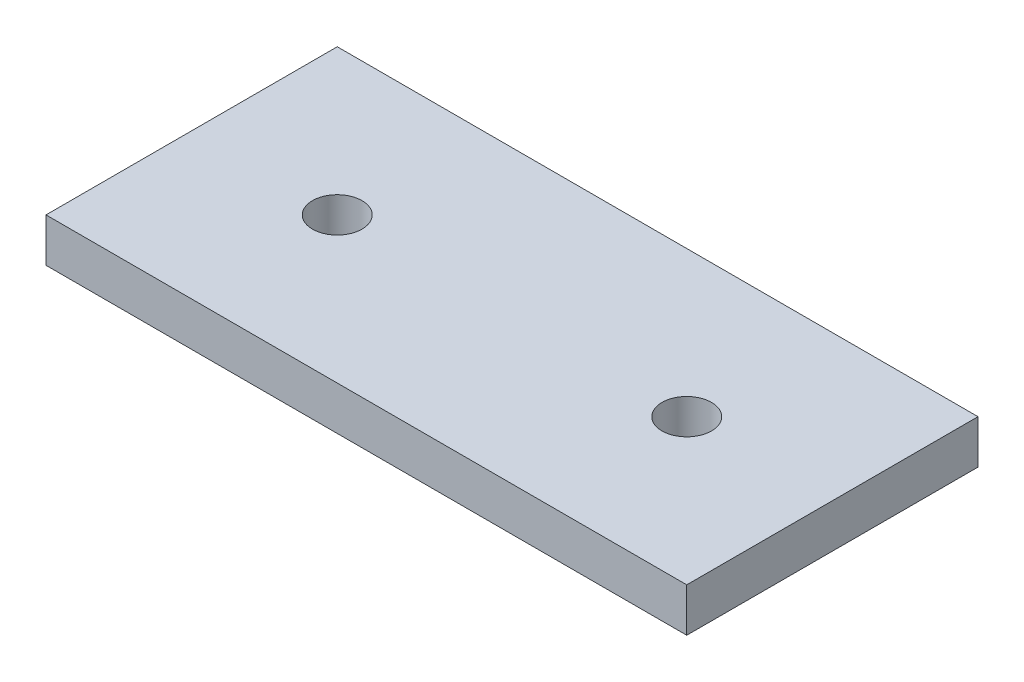
from build123d import *

# Parameters (mm, degrees)
SKETCH1_W             = 44
SKETCH1_H             = 20
JOINER_PLATE_DEPTH    = 3
BOLT_HOLES_DEPTH      = 25.351591324
BOLT_HOLES_DEPTH_BACK = 25.351591324
SKETCH2_R             = 1.7


with BuildPart() as part:
    # Sketch1 → Joiner Plate (new body)
    with BuildSketch(Plane(origin=(0, 0, 0), x_dir=(1, 0, 0), z_dir=(0, 1, 0))):
        Rectangle(SKETCH1_W, SKETCH1_H)
    extrude(amount=JOINER_PLATE_DEPTH)

    # Sketch2 → Bolt Holes (cut, two sides: drawn at the far end of the back side and taken through both)
    with BuildSketch(Plane(origin=(0, 0, 0), x_dir=(1, 0, 0), z_dir=(0, 1, 0)).offset(-BOLT_HOLES_DEPTH_BACK)):
        with Locations((-12, 0)):
            Circle(SKETCH2_R)
        with Locations((12, 0)):
            Circle(SKETCH2_R)
    extrude(amount=BOLT_HOLES_DEPTH + BOLT_HOLES_DEPTH_BACK, mode=Mode.SUBTRACT)


solid = part.part
